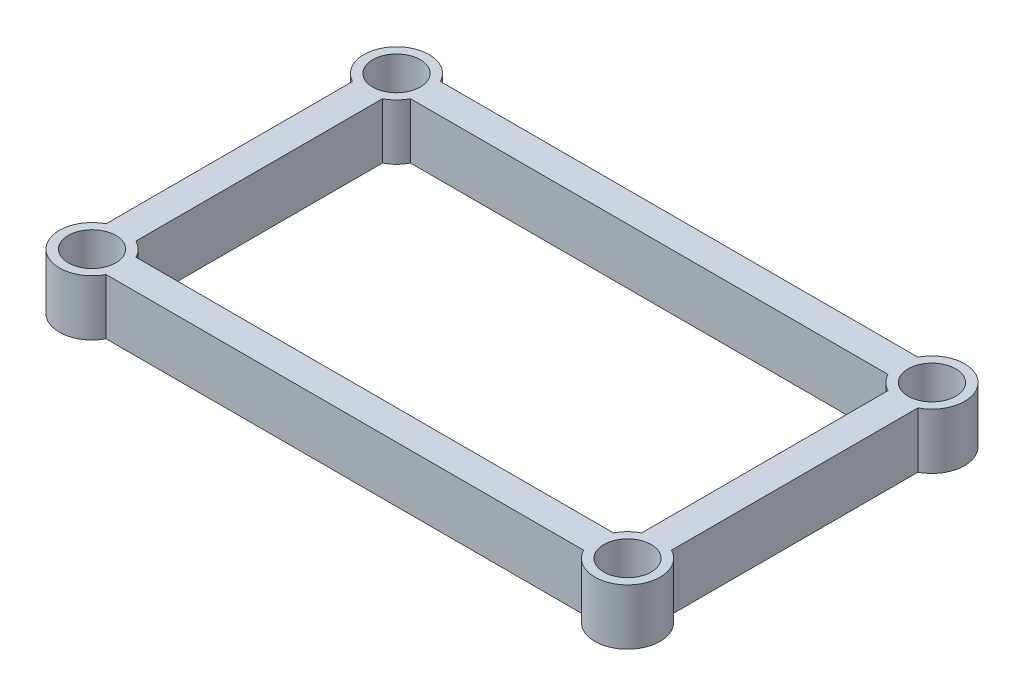
from build123d import *

# Parameters (mm, degrees)
SKETCH1_W           = 416
SKETCH1_H           = 246
BOSS_EXTRUDE1_DEPTH = 20.5
SKETCH2_W           = 372
SKETCH2_H           = 202
CUT_EXTRUDE1_DEPTH  = 30
SKETCH3_R           = 24
BOSS_EXTRUDE2_DEPTH = 20.5
SKETCH4_R           = 17.5
CUT_EXTRUDE2_DEPTH  = 30


with BuildPart() as part:
    # Sketch1 → Boss-Extrude1 (new, symmetric)
    with BuildSketch(Plane(origin=(0, 0, 0), x_dir=(1, 0, 0), z_dir=(0, 1, 0))):
        Rectangle(SKETCH1_W, SKETCH1_H)
    extrude(amount=BOSS_EXTRUDE1_DEPTH, both=True)

    # Sketch2 → Cut-Extrude1 (cut, symmetric)
    with BuildSketch(Plane(origin=(0, 0, 0), x_dir=(1, 0, 0), z_dir=(0, 1, 0))):
        Rectangle(SKETCH2_W, SKETCH2_H)
    extrude(amount=CUT_EXTRUDE1_DEPTH, both=True, mode=Mode.SUBTRACT)

    # Sketch3 → Boss-Extrude2 (add, symmetric)
    with BuildSketch(Plane(origin=(0, 0, 0), x_dir=(1, 0, 0), z_dir=(0, 1, 0))):
        with Locations((-197, -112)):
            Circle(SKETCH3_R)
        with Locations((-197, 112)):
            Circle(SKETCH3_R)
        with Locations((197, -112)):
            Circle(SKETCH3_R)
        with Locations((197, 112)):
            Circle(SKETCH3_R)
    extrude(amount=BOSS_EXTRUDE2_DEPTH, both=True)

    # Sketch4 → Cut-Extrude2 (cut, symmetric)
    with BuildSketch(Plane(origin=(0, 0, 0), x_dir=(1, 0, 0), z_dir=(0, 1, 0))):
        with Locations((-197, -112)):
            Circle(SKETCH4_R)
        with Locations((-197, 112)):
            Circle(SKETCH4_R)
        with Locations((197, -112)):
            Circle(SKETCH4_R)
        with Locations((197, 112)):
            Circle(SKETCH4_R)
    extrude(amount=CUT_EXTRUDE2_DEPTH, both=True, mode=Mode.SUBTRACT)


solid = part.part
